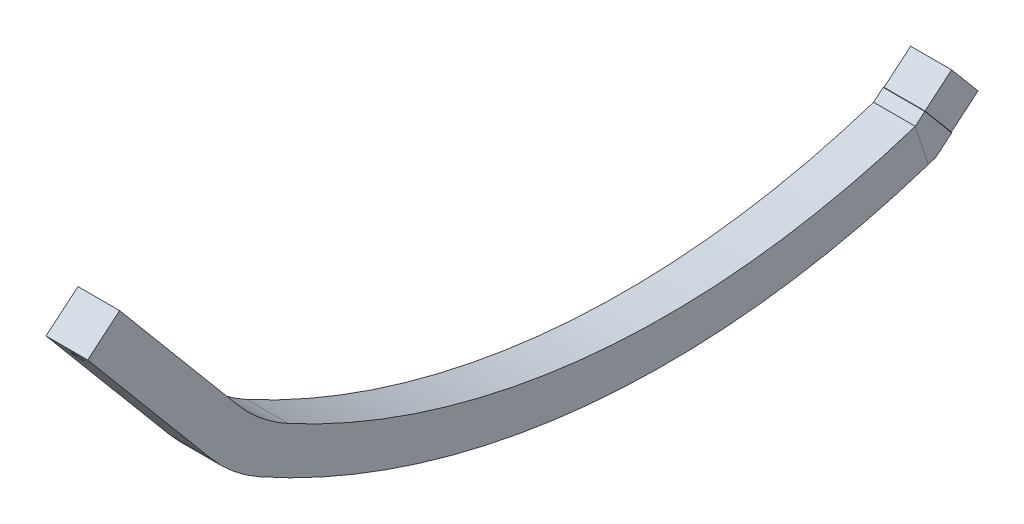
from build123d import *

# Parameters (mm, degrees)
AUFSATZ_LINEAR_AUSTRAGEN1_DEPTH = 12
AUFSATZ_LINEAR_AUSTRAGEN3_DEPTH = 12
AUFSATZ_LINEAR_AUSTRAGEN4_DEPTH = 12
SCHNITT_LINEAR_AUSTRAGEN1_DEPTH = 254.175024926
VERRUNDUNG1_R                   = 50
SKIZZE9_W                       = 12
SKIZZE9_H                       = 12
AUFSATZ_LINEAR_AUSTRAGEN6_DEPTH = 16
SKIZZE10_R                      = 9.036348878
SKIZZE10_W                      = 11.8
SKIZZE10_H                      = 11.8
SCHNITT_LINEAR_AUSTRAGEN3_DEPTH = 10
SKIZZE11_R                      = 1.55
SCHNITT_LINEAR_AUSTRAGEN4_DEPTH = 227.398704326
FASE1_SIZE                      = 0.1


with BuildPart() as part:
    # Skizze1 → Aufsatz-Linear austragen1 (new body)
    with BuildSketch(Plane(origin=(0, 0, 0), x_dir=(0, 0, -1), z_dir=(1, 0, 0))):
        with BuildLine():
            Line((-240, 65), (-230.735708163, 72.773663864))
            ThreePointArc((-230.735708163, 72.773663864), (-123.944567763, 17.242039243), (-3.735818811, 23.403668612))
            Line((-3.735818811, 23.403668612), (0, 12))
            ThreePointArc((0, 12), (-127.247502729, 5.681119716), (-240, 65))
        make_face()
    extrude(amount=AUFSATZ_LINEAR_AUSTRAGEN1_DEPTH)

    # Skizze5 → Aufsatz-Linear austragen4 (add)
    with BuildSketch(Plane(origin=(12, 0, 0), x_dir=(0, 0, -1), z_dir=(1, 0, 0))):
        Polygon((-231.662517154, 71.995978781), (-222.469983836, 79.709430098), (-210.899806862, 65.920630121), (-192.948331238, 44.526894555), (-220.092340179, 58.207178805), align=None)
    extrude(amount=-AUFSATZ_LINEAR_AUSTRAGEN4_DEPTH)

    # Skizze6 → Schnitt-Linear austragen1 (cut, through all)
    with BuildSketch(Plane(origin=(12, 0, 0), x_dir=(0, 0, -1), z_dir=(1, 0, 0))):
        Polygon((-231.662517154, 71.995978781), (-199.510648028, 33.678873242), (-204.367668784, 29.603348917), (-240, 65), align=None)
    extrude(amount=-SCHNITT_LINEAR_AUSTRAGEN1_DEPTH, mode=Mode.SUBTRACT)

    # Verrundung1
    verrundung1_edges = [part.edges().sort_by_distance(p)[0] for p in [
        (6, 44.526894555, 192.948331238),
        (6, 35.285406895, 200.858689823),
    ]]
    fillet(verrundung1_edges, radius=VERRUNDUNG1_R)

    # Skizze9 → Aufsatz-Linear austragen6 (add)
    with BuildSketch(Plane(origin=(0, 156.320496136, 131.168470653), x_dir=(1, 0, 0), z_dir=(0, 0.7660444431189836, 0.6427876096865328))):
        with Locations((6, -125.185660837)):
            Rectangle(SKIZZE9_W, SKIZZE9_H)
    extrude(amount=AUFSATZ_LINEAR_AUSTRAGEN6_DEPTH)

    # Skizze11 → Schnitt-Linear austragen4 (cut, through all)
    with BuildSketch(Plane(origin=(0, -76.611066038, 91.301513183), x_dir=(-1, 0, 0), z_dir=(0, 0.6427876096865329, -0.7660444431189836))):
        with Locations(Location((-6, 215.061915128, 0), (0, 0, 90))):
            Circle(SKIZZE11_R)
    extrude(amount=-SCHNITT_LINEAR_AUSTRAGEN4_DEPTH, mode=Mode.SUBTRACT)


with BuildPart() as body_2:
    # Skizze4 → Aufsatz-Linear austragen3 (new body)
    with BuildSketch(Plane(origin=(0, 0, 0), x_dir=(0, 0, -1), z_dir=(1, 0, 0))):
        with BuildLine():
            Line((-3.735818811, 23.403668612), (6.769031275, 32.218284445))
            Line((6.769031275, 32.218284445), (14.482482591, 23.025751128))
            Line((14.482482591, 23.025751128), (2.225771501, 12.741149373))
            ThreePointArc((2.225771501, 12.741149373), (1.113785782, 12.367871772), (0, 12))
            Line((0, 12), (-3.735818811, 23.403668612))
        make_face()
    extrude(amount=AUFSATZ_LINEAR_AUSTRAGEN3_DEPTH)

    # Skizze10 → Schnitt-Linear austragen3 (cut)
    with BuildSketch(Plane(origin=(0, 16.644916272, -19.836638765), x_dir=(-1, 0, 0), z_dir=(0, 0.6427876096865353, -0.7660444431189815))):
        with Locations((-6, 14.329588333)):
            Circle(SKIZZE10_R)
        with Locations((-6, 14.329588333)):
            Rectangle(SKIZZE10_W, SKIZZE10_H, mode=Mode.SUBTRACT)
    extrude(amount=-SCHNITT_LINEAR_AUSTRAGEN3_DEPTH, mode=Mode.SUBTRACT)

    # Fase1
    fase1_edges = [body_2.edges().sort_by_distance(p)[0] for p in [
        (0, 21.194141689, -2.965312502),
        (6, 16.597875031, -6.82203816),
        (6, 25.790408348, 0.891413156),
        (12, 21.194141689, -2.965312502),
    ]]
    chamfer(fase1_edges, length=FASE1_SIZE - 0.0001)  # a hair under: the kernel refuses the full size


solid = Compound([part.part, body_2.part])
